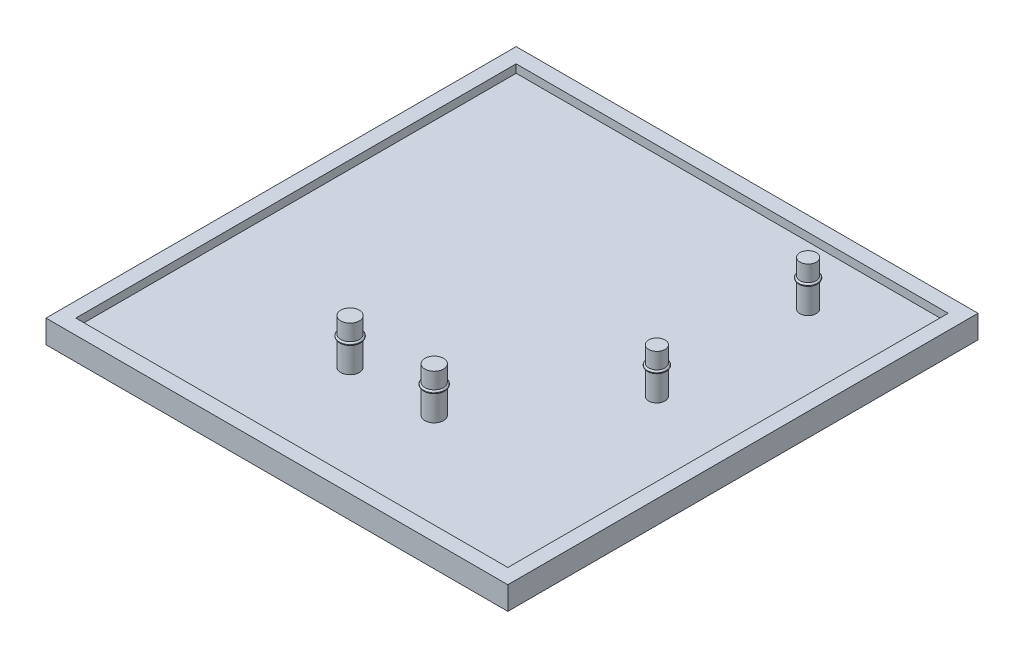
from build123d import *

# Parameters (mm, degrees)
SKETCH3_W             = 78.7146
SKETCH3_H             = 80.137
BOSS_EXTRUDE1_DEPTH   = 3.937
SHELL1_T              = -2.54
SKETCH4_R             = 1.397
SKETCH4_R_2           = 1.5875
BOSS_EXTRUDE2_DEPTH   = 7.62
SKETCH7_R             = 1.8415
BOSS_EXTRUDE3_DEPTH   = 0.508
BOSS_EXTRUDE3_2_DEPTH = 0.508
SKETCH7_R_2           = 1.651
BOSS_EXTRUDE3_3_DEPTH = 0.508
BOSS_EXTRUDE3_4_DEPTH = 0.508
FILLET1_R             = 0.254
FILLET2_R             = 0.254
FILLET4_R             = 0.254
FILLET5_R             = 0.254


with BuildPart() as part:
    # Sketch3 → Boss-Extrude1 (new body)
    with BuildSketch(Plane(origin=(0, 0, 0), x_dir=(1, 0, 0), z_dir=(0, 1, 0))):
        with Locations((39.3573, 40.0685)):
            Rectangle(SKETCH3_W, SKETCH3_H)
    extrude(amount=BOSS_EXTRUDE1_DEPTH)

    # Shell1
    shell1_openings = [part.faces().sort_by_distance(p)[0] for p in [
        (39.3573, 3.937, -40.0685),
    ]]
    offset(amount=SHELL1_T, openings=shell1_openings, kind=Kind.INTERSECTION)

    # Sketch4 → Boss-Extrude2 (add)
    with BuildSketch(Plane(origin=(0, 2.54, 0), x_dir=(1, 0, 0), z_dir=(0, 1, 0))):
        with Locations(Location((62.2046, 67.691, 0), (0, 0, 90))):
            Circle(SKETCH4_R)
        with Locations(Location((62.2046, 41.91, 0), (0, 0, 90))):
            Circle(SKETCH4_R)
        with Locations(Location((46.0375, 20.1295, 0), (0, 0, 90))):
            Circle(SKETCH4_R_2)
        with Locations(Location((31.7627, 20.066, 0), (0, 0, 90))):
            Circle(SKETCH4_R_2)
    extrude(amount=BOSS_EXTRUDE2_DEPTH)


with BuildPart() as body_2:
    # Sketch7 → Boss-Extrude3 (new body)
    with BuildSketch(Plane(origin=(0, 6.9088, 0), x_dir=(-1, 0, 0), z_dir=(0, -1, 0))):
        with Locations(Location((-31.7627, 20.066, 0), (0, 0, 90))):
            Circle(SKETCH7_R)
    extrude(amount=-BOSS_EXTRUDE3_DEPTH)

    # Fillet2
    fillet2_edges = [body_2.edges().sort_by_distance(p)[0] for p in [
        (31.7627, 6.9088, -18.2245),
        (31.7627, 7.4168, -18.2245),
    ]]
    fillet(fillet2_edges, radius=FILLET2_R - 0.0001)  # a hair under: the kernel refuses the full size


with BuildPart() as body_3:
    # Sketch7 → Boss-Extrude3 2 (new body)
    with BuildSketch(Plane(origin=(0, 6.9088, 0), x_dir=(-1, 0, 0), z_dir=(0, -1, 0))):
        with Locations(Location((-46.0375, 20.1295, 0), (0, 0, 90))):
            Circle(SKETCH7_R)
    extrude(amount=-BOSS_EXTRUDE3_2_DEPTH)

    # Fillet1
    fillet1_edges = [body_3.edges().sort_by_distance(p)[0] for p in [
        (46.0375, 6.9088, -18.288),
        (46.0375, 7.4168, -18.288),
    ]]
    fillet(fillet1_edges, radius=FILLET1_R - 0.0001)  # a hair under: the kernel refuses the full size


with BuildPart() as body_4:
    # Sketch7 → Boss-Extrude3 3 (new body)
    with BuildSketch(Plane(origin=(0, 6.9088, 0), x_dir=(-1, 0, 0), z_dir=(0, -1, 0))):
        with Locations(Location((-62.2046, 41.91, 0), (0, 0, 90))):
            Circle(SKETCH7_R_2)
    extrude(amount=-BOSS_EXTRUDE3_3_DEPTH)

    # Fillet4
    fillet4_edges = [body_4.edges().sort_by_distance(p)[0] for p in [
        (62.2046, 6.9088, -40.259),
        (62.2046, 7.4168, -40.259),
    ]]
    fillet(fillet4_edges, radius=FILLET4_R - 0.0001)  # a hair under: the kernel refuses the full size


with BuildPart() as body_5:
    # Sketch7 → Boss-Extrude3 4 (new body)
    with BuildSketch(Plane(origin=(0, 6.9088, 0), x_dir=(-1, 0, 0), z_dir=(0, -1, 0))):
        with Locations(Location((-62.2046, 67.691, 0), (0, 0, 90))):
            Circle(SKETCH7_R_2)
    extrude(amount=-BOSS_EXTRUDE3_4_DEPTH)

    # Fillet5
    fillet5_edges = [body_5.edges().sort_by_distance(p)[0] for p in [
        (62.2046, 6.9088, -66.04),
        (62.2046, 7.4168, -66.04),
    ]]
    fillet(fillet5_edges, radius=FILLET5_R - 0.0001)  # a hair under: the kernel refuses the full size


solid = Compound([part.part, body_2.part, body_3.part, body_4.part, body_5.part])
